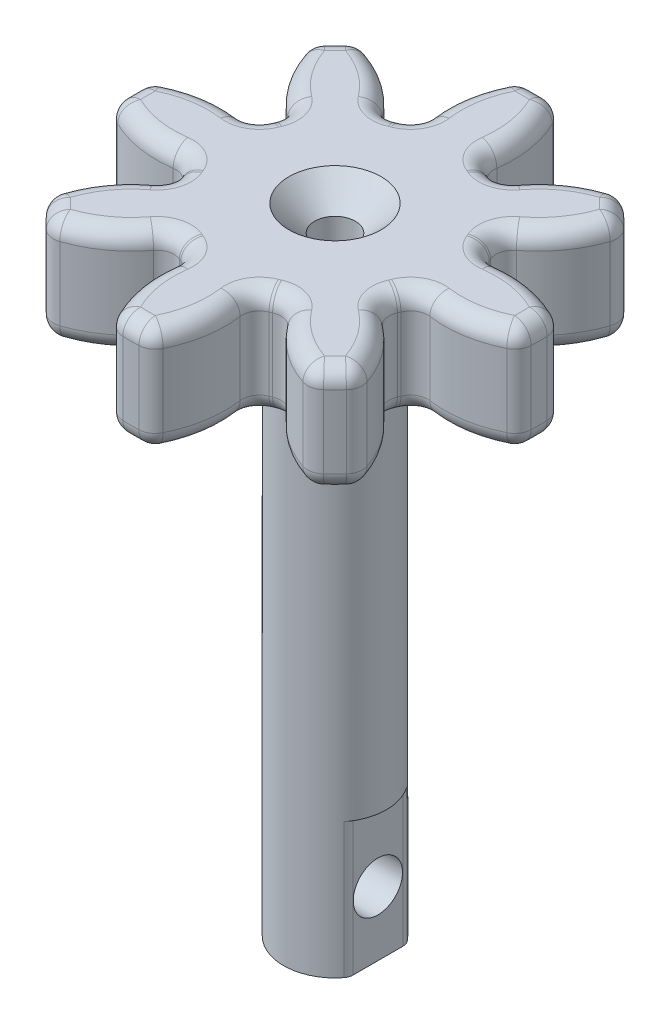
from build123d import *

# Parameters (mm, degrees)
BOSS_EXTRUDE1_DEPTH = 5
FILLET3_R           = 0.8
SKETCH4_R           = 2.4
BOSS_EXTRUDE2_DEPTH = 18.3
BOSS_EXTRUDE3_DEPTH = 6.3
FILLET4_R           = 0.5
SKETCH6_R           = 1.15
CUT_EXTRUDE1_DEPTH  = 10
SKETCH7_R           = 0.95
CUT_EXTRUDE2_DEPTH  = 22
CHAMFER1_SIZE       = 1.2


with BuildPart() as part:
    # Sketch2 → Boss-Extrude1 (new body)
    with BuildSketch(Plane(origin=(0, 0, 0), x_dir=(1, 0, 0), z_dir=(0, 1, 0))):
        with BuildLine():
            ThreePointArc((1.43114513, 5.34110634), (1.55747618, 7.47898855), (0.830108257, 9.493296317))
            ThreePointArc((0.830108257, 9.493296317), (0, 9.529520171), (-0.830108257, 9.493296317))
            ThreePointArc((-0.830108257, 9.493296317), (-1.55747618, 7.47898855), (-1.43114513, 5.34110634))
            ThreePointArc((-1.43114513, 5.34110634), (-2.116055758, 5.10861051), (-2.764760085, 4.788704938))
            ThreePointArc((-2.764760085, 4.788704938), (-4.187141552, 6.389745488), (-6.125799024, 7.299749379))
            ThreePointArc((-6.125799024, 7.299749379), (-6.738388334, 6.738388334), (-7.299749379, 6.125799024))
            ThreePointArc((-7.299749379, 6.125799024), (-6.389745488, 4.187141552), (-4.788704938, 2.764760085))
            ThreePointArc((-4.788704938, 2.764760085), (-5.10861051, 2.116055758), (-5.34110634, 1.43114513))
            ThreePointArc((-5.34110634, 1.43114513), (-7.47898855, 1.55747618), (-9.493296317, 0.830108257))
            ThreePointArc((-9.493296317, 0.830108257), (-9.529520171, 0), (-9.493296317, -0.830108257))
            ThreePointArc((-9.493296317, -0.830108257), (-7.47898855, -1.55747618), (-5.34110634, -1.43114513))
            ThreePointArc((-5.34110634, -1.43114513), (-5.10861051, -2.116055758), (-4.788704938, -2.764760085))
            ThreePointArc((-4.788704938, -2.764760085), (-6.389745488, -4.187141552), (-7.299749379, -6.125799024))
            ThreePointArc((-7.299749379, -6.125799024), (-6.738388334, -6.738388334), (-6.125799024, -7.299749379))
            ThreePointArc((-6.125799024, -7.299749379), (-4.187141552, -6.389745488), (-2.764760085, -4.788704938))
            ThreePointArc((-2.764760085, -4.788704938), (-2.116055758, -5.10861051), (-1.43114513, -5.34110634))
            ThreePointArc((-1.43114513, -5.34110634), (-1.55747618, -7.47898855), (-0.830108257, -9.493296317))
            ThreePointArc((-0.830108257, -9.493296317), (0, -9.529520171), (0.830108257, -9.493296317))
            ThreePointArc((0.830108257, -9.493296317), (1.55747618, -7.47898855), (1.43114513, -5.34110634))
            ThreePointArc((1.43114513, -5.34110634), (2.116055758, -5.10861051), (2.764760085, -4.788704938))
            ThreePointArc((2.764760085, -4.788704938), (4.187141552, -6.389745488), (6.125799024, -7.299749379))
            ThreePointArc((6.125799024, -7.299749379), (6.738388334, -6.738388334), (7.299749379, -6.125799024))
            ThreePointArc((7.299749379, -6.125799024), (6.389745488, -4.187141552), (4.788704938, -2.764760085))
            ThreePointArc((4.788704938, -2.764760085), (5.10861051, -2.116055758), (5.34110634, -1.43114513))
            ThreePointArc((5.34110634, -1.43114513), (7.47898855, -1.55747618), (9.493296317, -0.830108257))
            ThreePointArc((9.493296317, -0.830108257), (9.529520171, 0), (9.493296317, 0.830108257))
            ThreePointArc((9.493296317, 0.830108257), (7.47898855, 1.55747618), (5.34110634, 1.43114513))
            ThreePointArc((5.34110634, 1.43114513), (5.10861051, 2.116055758), (4.788704938, 2.764760085))
            ThreePointArc((4.788704938, 2.764760085), (6.389745488, 4.187141552), (7.299749379, 6.125799024))
            ThreePointArc((7.299749379, 6.125799024), (6.738388334, 6.738388334), (6.125799024, 7.299749379))
            ThreePointArc((6.125799024, 7.299749379), (4.187141552, 6.389745488), (2.764760085, 4.788704938))
            ThreePointArc((2.764760085, 4.788704938), (2.116055758, 5.10861051), (1.43114513, 5.34110634))
        make_face()
    extrude(amount=BOSS_EXTRUDE1_DEPTH)

    # Fillet3
    fillet3_edges = [part.edges().sort_by_distance(p)[0] for p in [
        (5.10861051, 5, 2.116055758),
        (7.47898855, 5, 1.55747618),
        (9.529520171, 5, 0),
        (7.47898855, 5, -1.55747618),
        (5.10861051, 5, -2.116055758),
        (6.389745488, 5, -4.187141552),
        (6.738388334, 5, -6.738388334),
        (4.187141552, 5, -6.389745488),
        (0, 5, -9.529520171),
        (-1.55747618, 5, -7.47898855),
        (-2.116055758, 5, -5.10861051),
        (-4.187141552, 5, -6.389745488),
        (-6.738388334, 5, -6.738388334),
        (4.187141552, 0, -6.389745488),
        (6.738388334, 0, -6.738388334),
        (6.389745488, 0, -4.187141552),
        (5.10861051, 0, -2.116055758),
        (7.47898855, 0, -1.55747618),
        (9.529520171, 0, 0),
        (7.47898855, 0, 1.55747618),
        (-6.389745488, 5, -4.187141552),
        (5.10861051, 0, 2.116055758),
        (6.389745488, 0, 4.187141552),
        (6.738388334, 0, 6.738388334),
        (4.187141552, 0, 6.389745488),
        (2.116055758, 0, 5.10861051),
        (1.55747618, 0, 7.47898855),
        (0, 0, 9.529520171),
        (-1.55747618, 0, 7.47898855),
        (-2.116055758, 0, 5.10861051),
        (-4.187141552, 0, 6.389745488),
        (-5.10861051, 5, -2.116055758),
        (-6.738388334, 0, 6.738388334),
        (-6.389745488, 0, 4.187141552),
        (-5.10861051, 0, 2.116055758),
        (-7.47898855, 0, 1.55747618),
        (-9.529520171, 0, 0),
        (-7.47898855, 0, -1.55747618),
        (-5.10861051, 0, -2.116055758),
        (-6.389745488, 0, -4.187141552),
        (-6.738388334, 0, -6.738388334),
        (-4.187141552, 0, -6.389745488),
        (-7.47898855, 5, -1.55747618),
        (-2.116055758, 0, -5.10861051),
        (-1.55747618, 0, -7.47898855),
        (0, 0, -9.529520171),
        (1.55747618, 0, -7.47898855),
        (2.116055758, 0, -5.10861051),
        (-9.529520171, 5, 0),
        (-7.47898855, 5, 1.55747618),
        (2.116055758, 5, -5.10861051),
        (2.764760085, 2.5, -4.788704938),
        (6.125799024, 2.5, -7.299749379),
        (7.299749379, 2.5, -6.125799024),
        (-5.10861051, 5, 2.116055758),
        (4.788704938, 2.5, -2.764760085),
        (5.34110634, 2.5, -1.43114513),
        (9.493296317, 2.5, -0.830108257),
        (9.493296317, 2.5, 0.830108257),
        (5.34110634, 2.5, 1.43114513),
        (4.788704938, 2.5, 2.764760085),
        (7.299749379, 2.5, 6.125799024),
        (6.125799024, 2.5, 7.299749379),
        (2.764760085, 2.5, 4.788704938),
        (1.43114513, 2.5, 5.34110634),
        (0.830108257, 2.5, 9.493296317),
        (-0.830108257, 2.5, 9.493296317),
        (-1.43114513, 2.5, 5.34110634),
        (-2.764760085, 2.5, 4.788704938),
        (-6.125799024, 2.5, 7.299749379),
        (-7.299749379, 2.5, 6.125799024),
        (-4.788704938, 2.5, 2.764760085),
        (-5.34110634, 2.5, 1.43114513),
        (-9.493296317, 2.5, 0.830108257),
        (-9.493296317, 2.5, -0.830108257),
        (-5.34110634, 2.5, -1.43114513),
        (-4.788704938, 2.5, -2.764760085),
        (-7.299749379, 2.5, -6.125799024),
        (-6.125799024, 2.5, -7.299749379),
        (-2.764760085, 2.5, -4.788704938),
        (-1.43114513, 2.5, -5.34110634),
        (-0.830108257, 2.5, -9.493296317),
        (0.830108257, 2.5, -9.493296317),
        (1.43114513, 2.5, -5.34110634),
        (-6.389745488, 5, 4.187141552),
        (-6.738388334, 5, 6.738388334),
        (-4.187141552, 5, 6.389745488),
        (-2.116055758, 5, 5.10861051),
        (-1.55747618, 5, 7.47898855),
        (0, 5, 9.529520171),
        (1.55747618, 5, 7.47898855),
        (2.116055758, 5, 5.10861051),
        (4.187141552, 5, 6.389745488),
        (1.55747618, 5, -7.47898855),
        (6.738388334, 5, 6.738388334),
        (6.389745488, 5, 4.187141552),
    ]]
    fillet(fillet3_edges, radius=FILLET3_R)

    # Sketch4 → Boss-Extrude2 (add)
    with BuildSketch(Plane.XZ):
        with Locations(Location((0, 0, 0), (0, 0, 270))):
            Circle(SKETCH4_R)
    extrude(amount=BOSS_EXTRUDE2_DEPTH)

    # Sketch5 → Boss-Extrude3 (add)
    with BuildSketch(Plane.XZ.offset(18.3)):
        with BuildLine():
            Line((-2, 1.326649916), (-2, -1.326649916))
            ThreePointArc((-2, -1.326649916), (0, -2.4), (2, -1.326649916))
            Line((2, -1.326649916), (2, 1.326649916))
            ThreePointArc((2, 1.326649916), (0, 2.4), (-2, 1.326649916))
        make_face()
    extrude(amount=BOSS_EXTRUDE3_DEPTH)

    # Fillet4
    # the kernel refuses this fillet: 0.5 mm, written as the material it takes off along each edge
    with BuildSketch(Plane(origin=(2, -18.3, 1.326649916), x_dir=(-0.5836897127350739, 0, 0.8119767972345313), z_dir=(0, -1, 0)), Plane(origin=(-2, -18.3, -1.326649916), x_dir=(0.5836897127350733, 0, -0.8119767972345315), z_dir=(0, -1, 0))) as fillet4_piece_1:
        with BuildLine():
            CenterArc((0.161555435, 0.49964698), FILLET4_R, 234.289521938, 37.863646362)
            Line((-0.130289421, 0.093658581), (0, 0))
            ThreePointArc((0, 0), (0.090170476, -0.001694497), (0.180340951, 0))
        make_face()
    extrude(amount=6.750852378, mode=Mode.SUBTRACT)
    with BuildSketch(Plane(origin=(-2, -18.3, 1.326649916), x_dir=(0.5836897127350731, 0, 0.8119767972345318), z_dir=(0, -1, 0)), Plane(origin=(2, -18.3, -1.326649916), x_dir=(-0.5836897127350722, 0, -0.8119767972345324), z_dir=(0, -1, 0))) as fillet4_piece_2:
        with BuildLine():
            CenterArc((0.161555435, -0.49964698), FILLET4_R, 87.8468317, 37.863646362)
            Line((-0.130289421, -0.093658581), (0, 0))
            ThreePointArc((0, 0), (0.090170476, 0.001694497), (0.180340951, 0))
        make_face()
    extrude(amount=6.750852378, mode=Mode.SUBTRACT)

    # Sketch6 → Cut-Extrude1 (cut)
    with BuildSketch(Plane(origin=(2, 0, 0), x_dir=(0, 0, -1), z_dir=(1, 0, 0))):
        with Locations((0, -21.6)):
            Circle(SKETCH6_R)
    extrude(amount=-CUT_EXTRUDE1_DEPTH, mode=Mode.SUBTRACT)

    # Sketch7 → Cut-Extrude2 (cut)
    with BuildSketch(Plane(origin=(0, 5, 0), x_dir=(1, 0, 0), z_dir=(0, 1, 0))):
        with Locations(Location((0, 0, 0), (0, 0, 270))):
            Circle(SKETCH7_R)
    extrude(amount=-CUT_EXTRUDE2_DEPTH, mode=Mode.SUBTRACT)

    # Chamfer1
    chamfer1_edges = [part.edges().sort_by_distance(p)[0] for p in [
        (0, 5, -0.95),
    ]]
    chamfer(chamfer1_edges, length=CHAMFER1_SIZE)


solid = part.part
